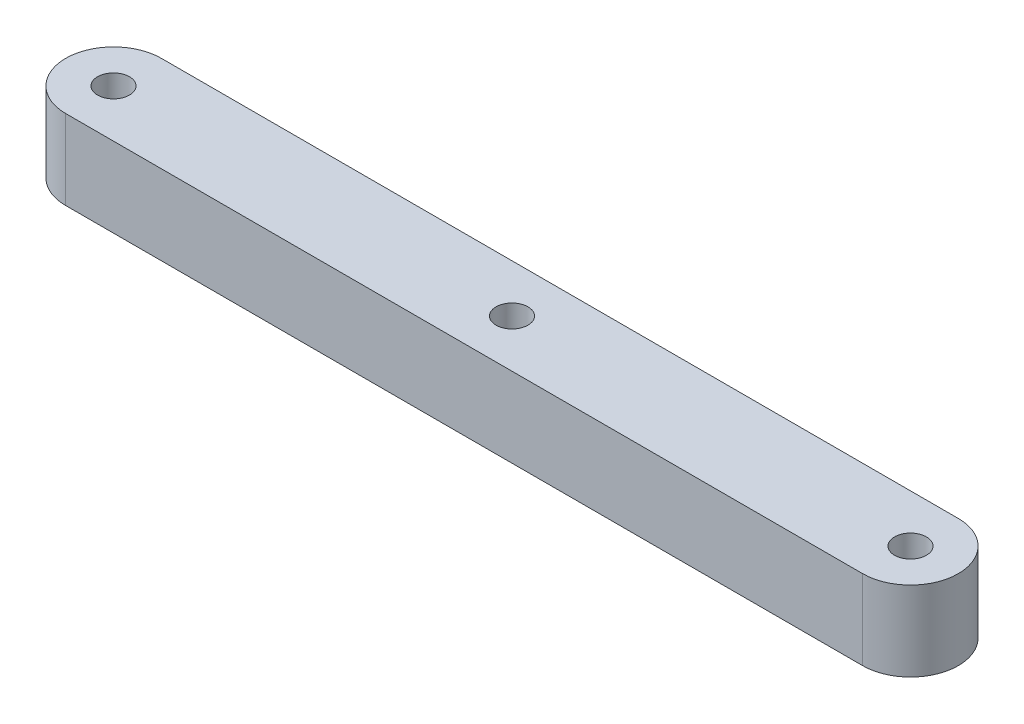
from build123d import *

# Parameters (mm, degrees)
BOSS_EXTRUDE1_DEPTH = 12.7
SKETCH4_R           = 2.54
CUT_EXTRUDE3_DEPTH  = 73.645776202


with BuildPart() as part:
    # Sketch3 → Boss-Extrude1 (new body)
    with BuildSketch(Plane(origin=(0, 0, 0), x_dir=(1, 0, 0), z_dir=(0, 1, 0))):
        with BuildLine():
            Line((-63.5, 7.62), (63.5, 7.62))
            ThreePointArc((63.5, 7.62), (71.12, 0), (63.5, -7.62))
            Line((63.5, -7.62), (-63.5, -7.62))
            ThreePointArc((-63.5, -7.62), (-71.12, 0), (-63.5, 7.62))
        make_face()
    extrude(amount=BOSS_EXTRUDE1_DEPTH)

    # Sketch4 → Cut-Extrude3 (cut, through all)
    with BuildSketch(Plane(origin=(0, 12.7, 0), x_dir=(1, 0, 0), z_dir=(0, 1, 0))):
        with Locations((-63.5, 0)):
            Circle(SKETCH4_R)
        with Locations((63.5, 0)):
            Circle(SKETCH4_R)
        Circle(SKETCH4_R)
    extrude(amount=-CUT_EXTRUDE3_DEPTH, mode=Mode.SUBTRACT)


solid = part.part
